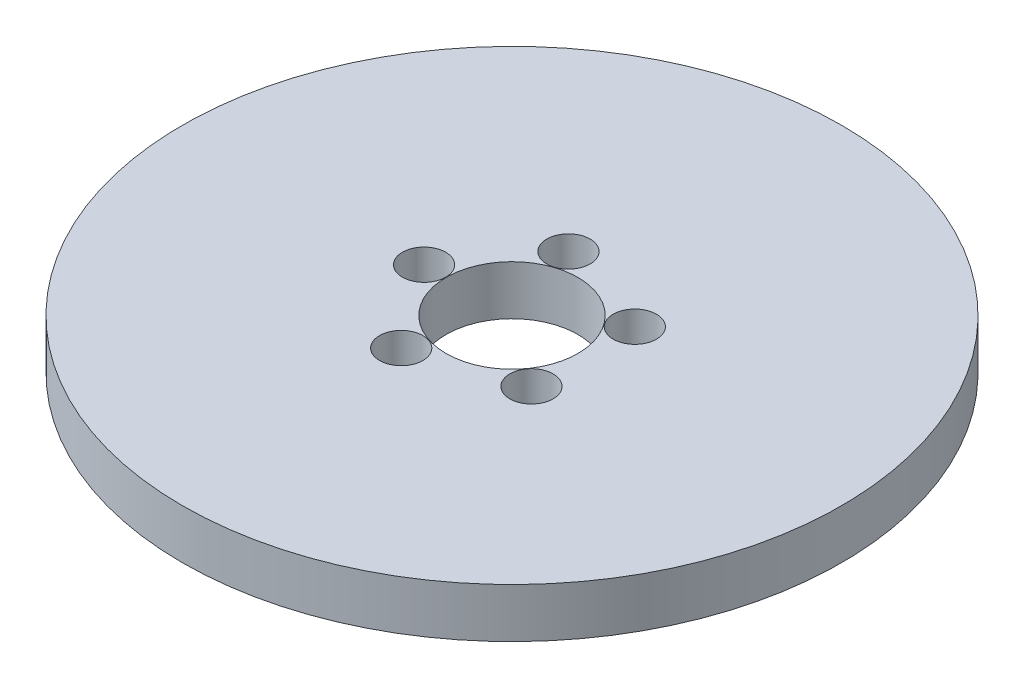
from build123d import *

# Parameters (mm, degrees)
SKETCH1_R           = 100
BOSS_EXTRUDE1_DEPTH = 15
SKETCH2_R           = 20
CUT_EXTRUDE1_DEPTH  = 143.214626533
SKETCH3_R           = 6.571569407
CUT_EXTRUDE2_DEPTH  = 13.917661723
CIRPATTERN1_COUNT   = 5


with BuildPart() as part:
    # Sketch1 → Boss-Extrude1 (new body)
    with BuildSketch(Plane(origin=(0, 0, 0), x_dir=(1, 0, 0), z_dir=(0, 1, 0))):
        Circle(SKETCH1_R)
    extrude(amount=BOSS_EXTRUDE1_DEPTH)

    # Sketch2 → Cut-Extrude1 (cut, through all)
    with BuildSketch(Plane(origin=(0, 0, 0), x_dir=(1, 0, 0), z_dir=(0, 1, 0))):
        Circle(SKETCH2_R)
    extrude(amount=CUT_EXTRUDE1_DEPTH, mode=Mode.SUBTRACT)

    # Sketch3 → Cut-Extrude2 (cut)
    with BuildSketch(Plane(origin=(0, 15, 0), x_dir=(1, 0, 0), z_dir=(0, 1, 0))):
        with Locations((-26.677883636, 0)):
            Circle(SKETCH3_R)
    cut_extrude2 = extrude(amount=-CUT_EXTRUDE2_DEPTH, mode=Mode.SUBTRACT)

    # CirPattern1: Cut-Extrude2 ×5 about axis
    cirpattern1_axis = Axis((0, 0, 0), (0, 1, 0))
    for i in range(1, CIRPATTERN1_COUNT):
        add(cut_extrude2.rotate(cirpattern1_axis, i * 360 / CIRPATTERN1_COUNT), mode=Mode.SUBTRACT)


solid = part.part
